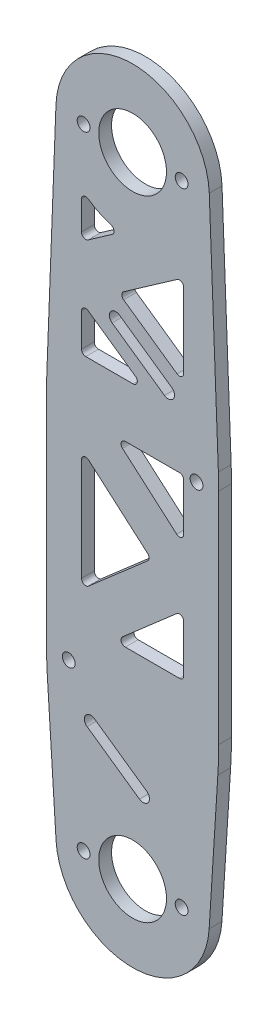
from build123d import *

# Parameters (mm, degrees)
SKETCH1_R               = 7.95
SKETCH1_R_2             = 1.5
MAIN_BODY_LINK_B1_DEPTH = 3
CUT_EXTRUDE2_REACH      = 168.945
CUT_EXTRUDE3_REACH      = 168.945
SKETCH5_R               = 1.5
PULLEYIDLERUP_DEPTH     = 3
CUT_EXTRUDE5_DEPTH      = 3
FILLET4_R               = 1
FILLET5_R               = 100


with BuildPart() as part:
    # Sketch1 → Main Body Link B1 (new body)
    with BuildSketch(Plane.XY):
        with BuildLine():
            Line((20.2, 41.674052381), (20.2, 83.474052381))
            Line((20.2, 83.474052381), (20.2, 90.874052381))
            Line((20.2, 90.874052381), (17.986683974, 148.383116621))
            ThreePointArc((17.986683974, 148.383116621), (0, 165.690874165), (-17.986683974, 148.383116621))
            Line((-17.986683974, 148.383116621), (-20.2, 90.874052381))
            Line((-20.2, 90.874052381), (-20.2, 83.474052381))
            Line((-20.2, 83.474052381), (-20.2, 41.674052381))
            Line((-20.2, 41.674052381), (-20.2, 34.274052381))
            Line((-20.2, 34.274052381), (-17.964224051, -1.134307826))
            ThreePointArc((-17.964224051, -1.134307826), (0, -18), (17.964224051, -1.134307826))
            Line((17.964224051, -1.134307826), (20.2, 34.274052381))
            Line((20.2, 34.274052381), (20.2, 41.674052381))
        make_face()
        Circle(SKETCH1_R, mode=Mode.SUBTRACT)
        with Locations((15, 88.174052381)):
            Circle(SKETCH1_R_2, mode=Mode.SUBTRACT)
        with Locations((-15, 37.024052381)):
            Circle(SKETCH1_R_2, mode=Mode.SUBTRACT)
        with Locations((0, 147.690874165)):
            Circle(SKETCH1_R, mode=Mode.SUBTRACT)
    extrude(amount=MAIN_BODY_LINK_B1_DEPTH)

    # Sketch4 → Cut-Extrude2 (cut, up to next)
    with BuildSketch(Plane.XY.offset(3), mode=Mode.PRIVATE) as cut_extrude2_sk1:
        with BuildLine():
            Line((-12, 134.2744663), (-12, 123.584968066))
            Line((-12, 123.584968066), (-2.929911079, 129.930929878))
            ThreePointArc((-2.929911079, 129.930929878), (-7.774454217, 131.456408925), (-12, 134.2744663))
        make_face()
    cut_extrude2_tool1 = extrude(cut_extrude2_sk1.sketch, amount=-CUT_EXTRUDE2_REACH, mode=Mode.PRIVATE) & part.part
    # Sketch4 → Cut-Extrude2 (cut, up to next)
    with BuildSketch(Plane.XY.offset(3), mode=Mode.PRIVATE) as cut_extrude2_sk2:
        Polygon((-12, 100.690874165), (3.278172542, 100.690874165), (-12, 111.380372399), align=None)
    cut_extrude2_tool2 = extrude(cut_extrude2_sk2.sketch, amount=-CUT_EXTRUDE2_REACH, mode=Mode.PRIVATE) & part.part
    # Sketch4 → Cut-Extrude2 (cut, up to next)
    with BuildSketch(Plane.XY.offset(3), mode=Mode.PRIVATE) as cut_extrude2_sk3:
        Polygon((12, 128.172168466), (12, 106.793171999), (-3.278172542, 117.482670232), align=None)
    cut_extrude2_tool3 = extrude(cut_extrude2_sk3.sketch, amount=-CUT_EXTRUDE2_REACH, mode=Mode.PRIVATE) & part.part
    # Sketch4 → Cut-Extrude2 (cut, up to next)
    with BuildSketch(Plane.XY.offset(3), mode=Mode.PRIVATE) as cut_extrude2_sk4:
        Polygon((-4.386441158, 88.090874165), (12, 88.090874165), (12, 73.82101499), align=None)
    cut_extrude2_tool4 = extrude(cut_extrude2_sk4.sketch, amount=-CUT_EXTRUDE2_REACH, mode=Mode.PRIVATE) & part.part
    # Sketch4 → Cut-Extrude2 (cut, up to next)
    with BuildSketch(Plane.XY.offset(3), mode=Mode.PRIVATE) as cut_extrude2_sk5:
        Polygon((-12, 81.46073334), (-12, 52.92101499), (4.386441158, 67.190874165), align=None)
    cut_extrude2_tool5 = extrude(cut_extrude2_sk5.sketch, amount=-CUT_EXTRUDE2_REACH, mode=Mode.PRIVATE) & part.part
    # Sketch4 → Cut-Extrude2 (cut, up to next)
    with BuildSketch(Plane.XY.offset(3), mode=Mode.PRIVATE) as cut_extrude2_sk6:
        Polygon((-4.386441158, 46.290874165), (12, 46.290874165), (12, 60.56073334), align=None)
    cut_extrude2_tool6 = extrude(cut_extrude2_sk6.sketch, amount=-CUT_EXTRUDE2_REACH, mode=Mode.PRIVATE) & part.part
    add(cut_extrude2_tool1.solids().sort_by_distance((-9.12997, 128.978342, 3))[0], mode=Mode.SUBTRACT)
    add(cut_extrude2_tool2.solids().sort_by_distance((-6.907276, 104.25404, 3))[0], mode=Mode.SUBTRACT)
    add(cut_extrude2_tool3.solids().sort_by_distance((6.907276, 117.48267, 3))[0], mode=Mode.SUBTRACT)
    add(cut_extrude2_tool4.solids().sort_by_distance((6.537853, 83.334254, 3))[0], mode=Mode.SUBTRACT)
    add(cut_extrude2_tool5.solids().sort_by_distance((-6.537853, 67.190874, 3))[0], mode=Mode.SUBTRACT)
    add(cut_extrude2_tool6.solids().sort_by_distance((6.537853, 51.047494, 3))[0], mode=Mode.SUBTRACT)

    # Sketch5 → Cut-Extrude3 (cut, up to next)
    with BuildSketch(Plane.XY.offset(3), mode=Mode.PRIVATE) as cut_extrude3_sk1:
        with Locations((11.5, 147.690874165)):
            Circle(SKETCH5_R)
    cut_extrude3_tool1 = extrude(cut_extrude3_sk1.sketch, amount=-CUT_EXTRUDE3_REACH, mode=Mode.PRIVATE) & part.part
    # Sketch5 → Cut-Extrude3 (cut, up to next)
    with BuildSketch(Plane.XY.offset(3), mode=Mode.PRIVATE) as cut_extrude3_sk2:
        with Locations((-11.5, 147.690874165)):
            Circle(SKETCH5_R)
    cut_extrude3_tool2 = extrude(cut_extrude3_sk2.sketch, amount=-CUT_EXTRUDE3_REACH, mode=Mode.PRIVATE) & part.part
    # Sketch5 → Cut-Extrude3 (cut, up to next)
    with BuildSketch(Plane.XY.offset(3), mode=Mode.PRIVATE) as cut_extrude3_sk3:
        with Locations((-11.5, 0)):
            Circle(SKETCH5_R)
    cut_extrude3_tool3 = extrude(cut_extrude3_sk3.sketch, amount=-CUT_EXTRUDE3_REACH, mode=Mode.PRIVATE) & part.part
    # Sketch5 → Cut-Extrude3 (cut, up to next)
    with BuildSketch(Plane.XY.offset(3), mode=Mode.PRIVATE) as cut_extrude3_sk4:
        with Locations((11.5, 0)):
            Circle(SKETCH5_R)
    cut_extrude3_tool4 = extrude(cut_extrude3_sk4.sketch, amount=-CUT_EXTRUDE3_REACH, mode=Mode.PRIVATE) & part.part
    add(cut_extrude3_tool1.solids().sort_by_distance((11.5, 147.690874, 3))[0], mode=Mode.SUBTRACT)
    add(cut_extrude3_tool2.solids().sort_by_distance((-11.5, 147.690874, 3))[0], mode=Mode.SUBTRACT)
    add(cut_extrude3_tool3.solids().sort_by_distance((-11.5, 0, 3))[0], mode=Mode.SUBTRACT)
    add(cut_extrude3_tool4.solids().sort_by_distance((11.5, 0, 3))[0], mode=Mode.SUBTRACT)

    # Sketch6 → PulleyIdlerUp (cut)
    with BuildSketch(Plane.XY.offset(3)):
        with BuildLine():
            Line((-4.812543936, 110.623218529), (7.477908291, 102.024103222))
            ThreePointArc((7.477908291, 102.024103222), (9.566865044, 102.393236914), (9.197731352, 104.482193668))
            Line((9.197731352, 104.482193668), (-3.092720875, 113.081308975))
            ThreePointArc((-3.092720875, 113.081308975), (-5.181677628, 112.712175283), (-4.812543936, 110.623218529))
        make_face()
    extrude(amount=-PULLEYIDLERUP_DEPTH, mode=Mode.SUBTRACT)

    # Sketch7 → Cut-Extrude5 (cut)
    with BuildSketch(Plane.XY.offset(3)):
        with BuildLine():
            Line((-10.690189186, 25.65418917), (1.597091478, 17.050542625))
            ThreePointArc((1.597091478, 17.050542625), (3.686184199, 17.418906036), (3.317820787, 19.507998757))
            Line((3.317820787, 19.507998757), (-8.969459877, 28.111645303))
            ThreePointArc((-8.969459877, 28.111645303), (-11.058552598, 27.743281891), (-10.690189186, 25.65418917))
        make_face()
    extrude(amount=-CUT_EXTRUDE5_DEPTH, mode=Mode.SUBTRACT)

    # Fillet4
    fillet4_edges = [part.edges().sort_by_distance(p)[0] for p in [
        (-12, 81.46073334, 1.5),
        (4.386441158, 67.190874165, 1.5),
        (-12, 52.92101499, 1.5),
        (-12, 134.2744663, 1.5),
        (-2.929911079, 129.930929878, 1.5),
        (-12, 123.584968066, 1.5),
        (-12, 100.690874165, 1.5),
        (-12, 111.380372399, 1.5),
        (3.278172542, 100.690874165, 1.5),
        (12, 106.793171999, 1.5),
        (-3.278172542, 117.482670232, 1.5),
        (12, 128.172168466, 1.5),
        (12, 60.56073334, 1.5),
        (12, 46.290874165, 1.5),
        (-4.386441158, 46.290874165, 1.5),
        (12, 88.090874165, 1.5),
        (12, 73.82101499, 1.5),
        (-4.386441158, 88.090874165, 1.5),
    ]]
    fillet(fillet4_edges, radius=FILLET4_R)

    # Fillet5
    # the kernel refuses this fillet: 100 mm, written as the material it takes off along each edge
    with BuildSketch(Plane(origin=(-20.2, 34.274052381, -7.884973578), x_dir=(0, 1, 0), z_dir=(0, 0, 1))) as fillet5_piece_1:
        with BuildLine():
            CenterArc((FILLET5_R * 0.0315398943126, -FILLET5_R), FILLET5_R, 90, 3.613007947)
            Line((-FILLET5_R * 0.0314772071099, -FILLET5_R * 0.00198755271875), (0, 0))
            Line((0, 0), (FILLET5_R * 0.0315398943126, 0))
        make_face()
    extrude(amount=18.769947156, mode=Mode.SUBTRACT)
    with BuildSketch(Plane(origin=(-20.2, 90.874052381, -4.809018086), x_dir=(0.03845791424359976, 0.9992602207793684, 0), z_dir=(0, 0, 1))) as fillet5_piece_2:
        with BuildLine():
            CenterArc((FILLET5_R * 0.0192360723451, -FILLET5_R), FILLET5_R, 90, 2.204019698)
            Line((-FILLET5_R * 0.0192218418985, -FILLET5_R * 0.000739779220632), (0, 0))
            Line((0, 0), (FILLET5_R * 0.0192360723451, 0))
        make_face()
    extrude(amount=12.618036173, mode=Mode.SUBTRACT)
    with BuildSketch(Plane(origin=(20.2, 90.874052381, -4.809018086), x_dir=(-0.03845791424359111, 0.9992602207793686, 0), z_dir=(0, 0, 1))) as fillet5_piece_3:
        with BuildLine():
            CenterArc((FILLET5_R * 0.0192360723451, FILLET5_R), FILLET5_R, 267.795980302, 2.204019698)
            Line((-FILLET5_R * 0.0192218418985, FILLET5_R * 0.000739779220631), (0, 0))
            Line((0, 0), (FILLET5_R * 0.0192360723451, 0))
        make_face()
    extrude(amount=12.618036173, mode=Mode.SUBTRACT)
    with BuildSketch(Plane(origin=(20.2, 34.274052381, -7.884973578), x_dir=(0, 1, 0), z_dir=(0, 0, 1))) as fillet5_piece_4:
        with BuildLine():
            CenterArc((FILLET5_R * 0.0315398943126, FILLET5_R), FILLET5_R, 266.386992053, 3.613007947)
            Line((-FILLET5_R * 0.0314772071099, FILLET5_R * 0.00198755271875), (0, 0))
            Line((0, 0), (FILLET5_R * 0.0315398943126, 0))
        make_face()
    extrude(amount=18.769947156, mode=Mode.SUBTRACT)


solid = part.part
